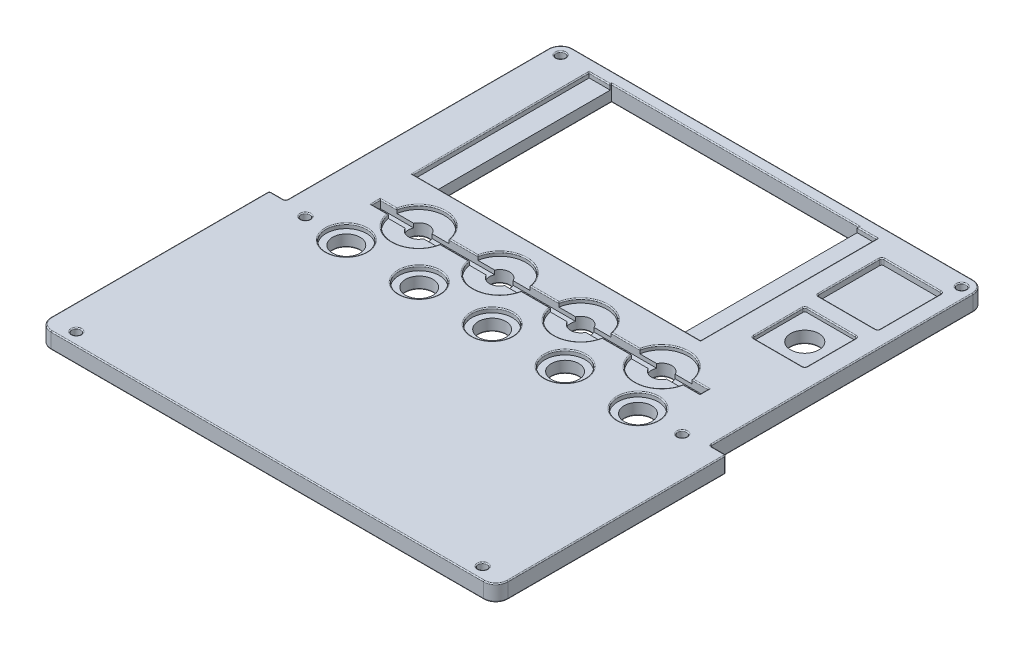
from build123d import *

# Parameters (mm, degrees)
MAIN_DEPTH                  = 4
DISPLAY_PCB_NOTCH_W         = 71
DISPLAY_PCB_NOTCH_H         = 43.5
PCB_NOTCH_DEPTH             = 1.2
DISPLAY_CUT_REACH           = 170.27
SKETCH4_W                   = 60.96
SKETCH4_H                   = 43.18
ROTARY_HOLE_REACH           = 170.27
SKETCH5_R                   = 3.5
MOUNTS_REACH                = 170.27
SKETCH6_R                   = 1.1
FILLET1_R                   = 3
TOGGLE_MOUNTS_REACH         = 170.27
SKETCH7_R                   = 2.5
SKETCH8_W                   = 81
SKETCH8_H                   = 2.1
TOGGLE_DIRECTION_DEPTH      = 2
SKETCH9_R                   = 6.5
TOGGLE_COUNTERSINKS_DEPTH   = 1
SKETCH10_W                  = 13
SKETCH10_H                  = 13
ENCODER_CLEARANCE_DEPTH     = 1
SKETCH11_W                  = 15
SKETCH11_H                  = 16
ENCODER_PIN_CLEARANCE_DEPTH = 1.5
FILLET2_R                   = 0.5
LED_MOUNTS_REACH            = 170.27
SKETCH12_R                  = 3.4
SKETCH13_R                  = 5
LED_COUNTERSINK_DEPTH       = 1.1
FILLET4_R                   = 0.25


with BuildPart() as part:
    # Sketch1 → Main (new body)
    with BuildSketch(Plane(origin=(0, 0, 0), x_dir=(1, 0, 0), z_dir=(0, 1, 0))):
        Polygon((112.8, 56.9), (108.8, 56.9), (108.8, 124.8), (4, 124.8), (4, 56.9), (0, 56.9), (0, 0), (112.8, 0), align=None)
    extrude(amount=MAIN_DEPTH)

    # Display PCB Notch → PCB Notch (cut)
    with BuildSketch(Plane.XZ.offset(-4)):
        with Locations((49.63, -99.97)):
            Rectangle(DISPLAY_PCB_NOTCH_W, DISPLAY_PCB_NOTCH_H)
    extrude(amount=PCB_NOTCH_DEPTH, mode=Mode.SUBTRACT)

    # Sketch4 → Display Cut (cut, up to next)
    with BuildSketch(Plane(origin=(0, 0, 0), x_dir=(-1, 0, 0), z_dir=(0, -1, 0)), mode=Mode.PRIVATE) as display_cut_sk1:
        with Locations((-49.81, 100.46)):
            Rectangle(SKETCH4_W, SKETCH4_H)
    display_cut_tool1 = extrude(display_cut_sk1.sketch, amount=-DISPLAY_CUT_REACH, mode=Mode.PRIVATE) & part.part
    add(display_cut_tool1.solids().sort_by_distance((49.81, 0, -100.46))[0], mode=Mode.SUBTRACT)

    # Sketch5 → Rotary Hole (cut, up to next)
    with BuildSketch(Plane.XZ, mode=Mode.PRIVATE) as rotary_hole_sk1:
        with Locations((97.32, -91.75)):
            Circle(SKETCH5_R)
    rotary_hole_tool1 = extrude(rotary_hole_sk1.sketch, amount=-ROTARY_HOLE_REACH, mode=Mode.PRIVATE) & part.part
    add(rotary_hole_tool1.solids().sort_by_distance((97.32, 0, -91.75))[0], mode=Mode.SUBTRACT)

    # Sketch6 → Mounts (cut, up to next)
    with BuildSketch(Plane.XZ, mode=Mode.PRIVATE) as mounts_sk1:
        with Locations((6.9, -121.9)):
            Circle(SKETCH6_R)
    mounts_tool1 = extrude(mounts_sk1.sketch, amount=-MOUNTS_REACH, mode=Mode.PRIVATE) & part.part
    # Sketch6 → Mounts (cut, up to next)
    with BuildSketch(Plane.XZ, mode=Mode.PRIVATE) as mounts_sk2:
        with Locations((9.9, -55.9)):
            Circle(SKETCH6_R)
    mounts_tool2 = extrude(mounts_sk2.sketch, amount=-MOUNTS_REACH, mode=Mode.PRIVATE) & part.part
    # Sketch6 → Mounts (cut, up to next)
    with BuildSketch(Plane.XZ, mode=Mode.PRIVATE) as mounts_sk3:
        with Locations((6.25, -3)):
            Circle(SKETCH6_R)
    mounts_tool3 = extrude(mounts_sk3.sketch, amount=-MOUNTS_REACH, mode=Mode.PRIVATE) & part.part
    # Sketch6 → Mounts (cut, up to next)
    with BuildSketch(Plane.XZ, mode=Mode.PRIVATE) as mounts_sk4:
        with Locations((105.9, -121.9)):
            Circle(SKETCH6_R)
    mounts_tool4 = extrude(mounts_sk4.sketch, amount=-MOUNTS_REACH, mode=Mode.PRIVATE) & part.part
    # Sketch6 → Mounts (cut, up to next)
    with BuildSketch(Plane.XZ, mode=Mode.PRIVATE) as mounts_sk5:
        with Locations((102.9, -55.9)):
            Circle(SKETCH6_R)
    mounts_tool5 = extrude(mounts_sk5.sketch, amount=-MOUNTS_REACH, mode=Mode.PRIVATE) & part.part
    # Sketch6 → Mounts (cut, up to next)
    with BuildSketch(Plane.XZ, mode=Mode.PRIVATE) as mounts_sk6:
        with Locations((106.55, -3)):
            Circle(SKETCH6_R)
    mounts_tool6 = extrude(mounts_sk6.sketch, amount=-MOUNTS_REACH, mode=Mode.PRIVATE) & part.part
    add(mounts_tool1.solids().sort_by_distance((6.9, 0, -121.9))[0], mode=Mode.SUBTRACT)
    add(mounts_tool2.solids().sort_by_distance((9.9, 0, -55.9))[0], mode=Mode.SUBTRACT)
    add(mounts_tool3.solids().sort_by_distance((6.25, 0, -3))[0], mode=Mode.SUBTRACT)
    add(mounts_tool4.solids().sort_by_distance((105.9, 0, -121.9))[0], mode=Mode.SUBTRACT)
    add(mounts_tool5.solids().sort_by_distance((102.9, 0, -55.9))[0], mode=Mode.SUBTRACT)
    add(mounts_tool6.solids().sort_by_distance((106.55, 0, -3))[0], mode=Mode.SUBTRACT)

    # Fillet1
    fillet1_edges = [part.edges().sort_by_distance(p)[0] for p in [
        (112.8, 2, 0),
        (108.8, 2, -124.8),
        (4, 2, -124.8),
        (0, 2, 0),
    ]]
    fillet(fillet1_edges, radius=FILLET1_R)

    # Sketch7 → Toggle Mounts (cut, up to next)
    with BuildSketch(Plane.XZ, mode=Mode.PRIVATE) as toggle_mounts_sk1:
        with Locations((26, -67.75)):
            Circle(SKETCH7_R)
    toggle_mounts_tool1 = extrude(toggle_mounts_sk1.sketch, amount=-TOGGLE_MOUNTS_REACH, mode=Mode.PRIVATE) & part.part
    # Sketch7 → Toggle Mounts (cut, up to next)
    with BuildSketch(Plane.XZ, mode=Mode.PRIVATE) as toggle_mounts_sk2:
        with Locations((46, -67.75)):
            Circle(SKETCH7_R)
    toggle_mounts_tool2 = extrude(toggle_mounts_sk2.sketch, amount=-TOGGLE_MOUNTS_REACH, mode=Mode.PRIVATE) & part.part
    # Sketch7 → Toggle Mounts (cut, up to next)
    with BuildSketch(Plane.XZ, mode=Mode.PRIVATE) as toggle_mounts_sk3:
        with Locations((66, -67.75)):
            Circle(SKETCH7_R)
    toggle_mounts_tool3 = extrude(toggle_mounts_sk3.sketch, amount=-TOGGLE_MOUNTS_REACH, mode=Mode.PRIVATE) & part.part
    # Sketch7 → Toggle Mounts (cut, up to next)
    with BuildSketch(Plane.XZ, mode=Mode.PRIVATE) as toggle_mounts_sk4:
        with Locations((86, -67.75)):
            Circle(SKETCH7_R)
    toggle_mounts_tool4 = extrude(toggle_mounts_sk4.sketch, amount=-TOGGLE_MOUNTS_REACH, mode=Mode.PRIVATE) & part.part
    add(toggle_mounts_tool1.solids().sort_by_distance((26, 0, -67.75))[0], mode=Mode.SUBTRACT)
    add(toggle_mounts_tool2.solids().sort_by_distance((46, 0, -67.75))[0], mode=Mode.SUBTRACT)
    add(toggle_mounts_tool3.solids().sort_by_distance((66, 0, -67.75))[0], mode=Mode.SUBTRACT)
    add(toggle_mounts_tool4.solids().sort_by_distance((86, 0, -67.75))[0], mode=Mode.SUBTRACT)

    # Sketch8 → Toggle Direction (cut)
    with BuildSketch(Plane.XZ.offset(-4)):
        with Locations((56, -67.75)):
            Rectangle(SKETCH8_W, SKETCH8_H)
    extrude(amount=TOGGLE_DIRECTION_DEPTH, mode=Mode.SUBTRACT)

    # Sketch9 → Toggle Countersinks (cut)
    with BuildSketch(Plane(origin=(0, 4, 0), x_dir=(1, 0, 0), z_dir=(0, 1, 0))):
        with Locations((26, 67.75)):
            Circle(SKETCH9_R)
        with Locations((46, 67.75)):
            Circle(SKETCH9_R)
        with Locations((66, 67.75)):
            Circle(SKETCH9_R)
        with Locations((86, 67.75)):
            Circle(SKETCH9_R)
    extrude(amount=-TOGGLE_COUNTERSINKS_DEPTH, mode=Mode.SUBTRACT)

    # Sketch10 → Encoder Clearance (cut)
    with BuildSketch(Plane(origin=(0, 4, 0), x_dir=(1, 0, 0), z_dir=(0, 1, 0))):
        with Locations((97.32, 91.75)):
            Rectangle(SKETCH10_W, SKETCH10_H)
    extrude(amount=-ENCODER_CLEARANCE_DEPTH, mode=Mode.SUBTRACT)

    # Sketch11 → Encoder Pin Clearance (cut)
    with BuildSketch(Plane(origin=(0, 4, 0), x_dir=(1, 0, 0), z_dir=(0, 1, 0))):
        with Locations((97.32, 110.25)):
            Rectangle(SKETCH11_W, SKETCH11_H)
    extrude(amount=-ENCODER_PIN_CLEARANCE_DEPTH, mode=Mode.SUBTRACT)

    # Fillet2
    fillet2_edges = [part.edges().sort_by_distance(p)[0] for p in [
        (0, 2, -56.9),
        (4, 2, -56.9),
        (112.8, 2, -56.9),
        (108.8, 2, -56.9),
        (89.82, 3.25, -102.25),
        (89.82, 3.25, -118.25),
        (104.82, 3.25, -118.25),
        (104.82, 3.25, -102.25),
        (103.82, 3.5, -85.25),
        (103.82, 3.5, -98.25),
        (90.82, 3.5, -98.25),
        (90.82, 3.5, -85.25),
    ]]
    fillet(fillet2_edges, radius=FILLET2_R)

    # Sketch12 → LED Mounts (cut, up to next)
    with BuildSketch(Plane(origin=(0, 4, 0), x_dir=(1, 0, 0), z_dir=(0, 1, 0)), mode=Mode.PRIVATE) as led_mounts_sk1:
        with Locations((20, 55.9)):
            Circle(SKETCH12_R)
    led_mounts_tool1 = extrude(led_mounts_sk1.sketch, amount=-LED_MOUNTS_REACH, mode=Mode.PRIVATE) & part.part
    # Sketch12 → LED Mounts (cut, up to next)
    with BuildSketch(Plane(origin=(0, 4, 0), x_dir=(1, 0, 0), z_dir=(0, 1, 0)), mode=Mode.PRIVATE) as led_mounts_sk2:
        with Locations((38, 55.9)):
            Circle(SKETCH12_R)
    led_mounts_tool2 = extrude(led_mounts_sk2.sketch, amount=-LED_MOUNTS_REACH, mode=Mode.PRIVATE) & part.part
    # Sketch12 → LED Mounts (cut, up to next)
    with BuildSketch(Plane(origin=(0, 4, 0), x_dir=(1, 0, 0), z_dir=(0, 1, 0)), mode=Mode.PRIVATE) as led_mounts_sk3:
        with Locations((56, 55.9)):
            Circle(SKETCH12_R)
    led_mounts_tool3 = extrude(led_mounts_sk3.sketch, amount=-LED_MOUNTS_REACH, mode=Mode.PRIVATE) & part.part
    # Sketch12 → LED Mounts (cut, up to next)
    with BuildSketch(Plane(origin=(0, 4, 0), x_dir=(1, 0, 0), z_dir=(0, 1, 0)), mode=Mode.PRIVATE) as led_mounts_sk4:
        with Locations((74, 55.9)):
            Circle(SKETCH12_R)
    led_mounts_tool4 = extrude(led_mounts_sk4.sketch, amount=-LED_MOUNTS_REACH, mode=Mode.PRIVATE) & part.part
    # Sketch12 → LED Mounts (cut, up to next)
    with BuildSketch(Plane(origin=(0, 4, 0), x_dir=(1, 0, 0), z_dir=(0, 1, 0)), mode=Mode.PRIVATE) as led_mounts_sk5:
        with Locations((92, 55.9)):
            Circle(SKETCH12_R)
    led_mounts_tool5 = extrude(led_mounts_sk5.sketch, amount=-LED_MOUNTS_REACH, mode=Mode.PRIVATE) & part.part
    add(led_mounts_tool1.solids().sort_by_distance((20, 4, -55.9))[0], mode=Mode.SUBTRACT)
    add(led_mounts_tool2.solids().sort_by_distance((38, 4, -55.9))[0], mode=Mode.SUBTRACT)
    add(led_mounts_tool3.solids().sort_by_distance((56, 4, -55.9))[0], mode=Mode.SUBTRACT)
    add(led_mounts_tool4.solids().sort_by_distance((74, 4, -55.9))[0], mode=Mode.SUBTRACT)
    add(led_mounts_tool5.solids().sort_by_distance((92, 4, -55.9))[0], mode=Mode.SUBTRACT)

    # Sketch13 → LED Countersink (cut)
    with BuildSketch(Plane(origin=(0, 4, 0), x_dir=(1, 0, 0), z_dir=(0, 1, 0))):
        with Locations((20, 55.9)):
            Circle(SKETCH13_R)
        with Locations((38, 55.9)):
            Circle(SKETCH13_R)
        with Locations((56, 55.9)):
            Circle(SKETCH13_R)
        with Locations((74, 55.9)):
            Circle(SKETCH13_R)
        with Locations((92, 55.9)):
            Circle(SKETCH13_R)
    extrude(amount=-LED_COUNTERSINK_DEPTH, mode=Mode.SUBTRACT)

    # Fillet4
    fillet4_edges = [part.edges().sort_by_distance(p)[0] for p in [
        (4, 4, -89.6),
        (4.878679656, 4, -123.921320344),
        (56.4, 4, -124.8),
        (111.921320344, 4, -0.878679656),
        (56.4, 4, 0),
        (4, 0, -89.6),
        (4.878679656, 0, -123.921320344),
        (56.4, 0, -124.8),
        (112.8, 0, -29.7),
        (111.921320344, 0, -0.878679656),
        (56.4, 0, 0),
        (108.946446609, 4, -57.046446609),
        (108.946446609, 0, -57.046446609),
        (3.853553391, 4, -57.046446609),
        (3.853553391, 0, -57.046446609),
        (90.966446609, 4, -85.396446609),
        (90.966446609, 4, -98.103553391),
        (103.673553391, 4, -98.103553391),
        (103.673553391, 4, -85.396446609),
        (104.673553391, 4, -102.396446609),
        (104.673553391, 4, -118.103553391),
        (89.966446609, 4, -118.103553391),
        (89.966446609, 4, -102.396446609),
        (0.146446609, 4, -56.753553391),
        (112.653553391, 4, -56.753553391),
        (0.146446609, 0, -56.753553391),
        (112.653553391, 0, -56.753553391),
        (107.921320344, 4, -123.921320344),
        (0.878679656, 4, -0.878679656),
        (107.921320344, 0, -123.921320344),
        (0.878679656, 0, -0.878679656),
        (2, 4, -56.9),
        (108.8, 4, -89.6),
        (110.8, 4, -56.9),
        (112.8, 4, -29.7),
        (0, 4, -29.7),
        (2, 0, -56.9),
        (108.8, 0, -89.6),
        (110.8, 0, -56.9),
        (0, 0, -29.7),
        (49.63, 4, -78.22),
        (85.13, 4, -99.97),
        (82.71, 4, -121.72),
        (16.73, 4, -121.72),
        (14.13, 4, -99.97),
        (49.81, 0, -78.87),
        (80.29, 0, -100.46),
        (49.81, 0, -122.05),
        (19.33, 0, -100.46),
        (93.82, 0, -91.75),
        (8.8, 4, -55.9),
        (8.8, 0, -55.9),
        (5.15, 4, -3),
        (5.15, 0, -3),
        (105.45, 0, -3),
        (105.45, 4, -3),
        (101.8, 0, -55.9),
        (101.8, 4, -55.9),
        (104.8, 0, -121.9),
        (104.8, 4, -121.9),
        (23.5, 0, -67.75),
        (43.5, 0, -67.75),
        (63.5, 0, -67.75),
        (83.5, 0, -67.75),
        (17.542684144, 4, -68.8),
        (36, 4, -68.8),
        (56, 4, -68.8),
        (76, 4, -68.8),
        (94.457315856, 4, -68.8),
        (15.5, 4, -67.75),
        (94.457315856, 4, -66.7),
        (76, 4, -66.7),
        (56, 4, -66.7),
        (36, 4, -66.7),
        (17.542684144, 4, -66.7),
        (96.5, 4, -67.75),
        (26, 4, -74.25),
        (26, 4, -61.25),
        (46, 4, -74.25),
        (46, 4, -61.25),
        (66, 4, -74.25),
        (66, 4, -61.25),
        (86, 4, -74.25),
        (86, 4, -61.25),
        (97.32, 4, -85.25),
        (90.82, 4, -91.75),
        (97.32, 4, -98.25),
        (103.82, 4, -91.75),
        (97.32, 4, -118.25),
        (104.82, 4, -110.25),
        (97.32, 4, -102.25),
        (89.82, 4, -110.25),
        (88.6, 0, -55.9),
        (16.6, 0, -55.9),
        (34.6, 0, -55.9),
        (52.6, 0, -55.9),
        (70.6, 0, -55.9),
        (15, 4, -55.9),
        (33, 4, -55.9),
        (51, 4, -55.9),
        (69, 4, -55.9),
        (87, 4, -55.9),
        (5.8, 4, -121.9),
        (80.29, 4, -121.885),
        (49.81, 4, -122.05),
        (19.33, 4, -121.885),
        (5.8, 0, -121.9),
    ]]
    fillet(fillet4_edges, radius=FILLET4_R)


solid = part.part
